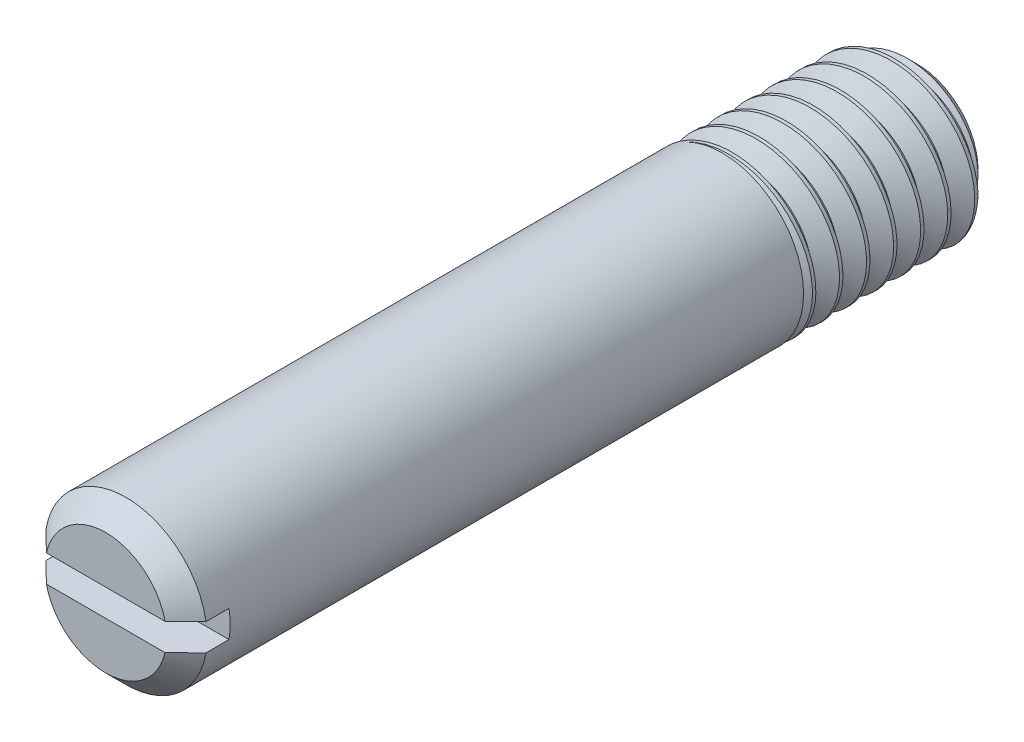
from build123d import *
from build123d.topology import SkipClean

# Parameters (mm, degrees)
SKETCH2_W               = 30
SKETCH2_H               = 3
CHAMFER2_SIZE           = 0.75
CUT_EXTRUDE1_DEPTH      = 24.191377708
CUT_EXTRUDE1_DEPTH_BACK = 24.191377708
SKETCH3_W               = 1.6
SKETCH3_H               = 1
CUT_SWEEP1_PITCH        = 1
BOSS_EXTRUDE2_START     = 1
SKETCH6_R               = 3
BOSS_EXTRUDE2_DEPTH     = 1


with BuildPart() as part:
    # Sketch2 → Revolve1 (revolve)
    with BuildSketch(Plane(origin=(0, 0, 0), x_dir=(0, 0, -1), z_dir=(1, 0, 0)), mode=Mode.PRIVATE) as revolve1_sk:
        with Locations((-7.8, 1.5)):
            Rectangle(SKETCH2_W, SKETCH2_H)
    revolve(revolve1_sk.sketch.rotate(Axis((0, 0, 22.8), (0, 0, -1)), 90), axis=Axis((0, 0, 22.8), (0, 0, -1)))

    # Chamfer2
    chamfer2_edges = [part.edges().sort_by_distance(p)[0] for p in [
        (-3, 0, 22.8),
        (-3, 0, -7.2),
    ]]
    chamfer(chamfer2_edges, length=CHAMFER2_SIZE)

    # Sketch3 → Cut-Extrude1 (cut, two sides: drawn at the far end of the back side and taken through both)
    with BuildSketch(Plane(origin=(0, 0, 0), x_dir=(0, 0, -1), z_dir=(1, 0, 0)).offset(-CUT_EXTRUDE1_DEPTH_BACK)):
        with Locations((-22, 0)):
            Rectangle(SKETCH3_W, SKETCH3_H)
    extrude(amount=CUT_EXTRUDE1_DEPTH + CUT_EXTRUDE1_DEPTH_BACK, mode=Mode.SUBTRACT)

    # Cut-Sweep1: the profile of Sketch5 profile screwed along a right-hand helix of 8.2 turns, 8 arcs to a turn; built about Z, then put on its axis
    cut_sweep1_z = Axis((0, 0, 0), (0, 0, 1))
    cut_sweep1_corners = [(3.0003, 0, 0.000173205), (3.0003, 0, -0.875173205), (2.350480947, 0, -0.5), (2.350480947, 0, -0.375)]
    with BuildLine(mode=Mode.PRIVATE) as cut_sweep1_profile:
        Line(cut_sweep1_corners[0], cut_sweep1_corners[1])
        Line(cut_sweep1_corners[1], cut_sweep1_corners[2])
        Line(cut_sweep1_corners[2], cut_sweep1_corners[3])
        Line(cut_sweep1_corners[3], cut_sweep1_corners[0])
    cut_sweep1_cap = Face(cut_sweep1_profile.wire())
    cut_sweep1_turn_angles = [0, 22.5, 45, 67.5, 90, 112.5, 135, 157.5, 180, 202.5, 225, 247.5, 270, 292.5, 315, 337.5, 360]
    cut_sweep1_turn_weights = [1, 0.9238795325112867, 1, 0.9238795325112867, 1, 0.9238795325112867, 1, 0.9238795325112867, 1, 0.9238795325112867, 1, 0.9238795325112867, 1, 0.9238795325112867, 1, 0.9238795325112867, 1]
    cut_sweep1_turn_rails = [Edge.make_bspline([Vector(p[0], p[1], 0).rotate(cut_sweep1_z, cut_sweep1_turn_angles[k]) / cut_sweep1_turn_weights[k] + Vector(0, 0, p[2] + CUT_SWEEP1_PITCH * cut_sweep1_turn_angles[k] / 360) for k in range(17)], [0, 0, 0, 1, 1, 2, 2, 3, 3, 4, 4, 5, 5, 6, 6, 7, 7, 8, 8, 8], 2, cut_sweep1_turn_weights) for p in cut_sweep1_corners]
    cut_sweep1_turn_sides = [Face.make_surface_from_curves(cut_sweep1_turn_rails[p[0]], cut_sweep1_turn_rails[p[1]]) for p in [(0, 1), (1, 2), (2, 3), (3, 0)]]
    cut_sweep1_last_angles = [2880, 2902.5, 2925, 2938.5, 2952]
    cut_sweep1_last_weights = [1, 0.9238795325112867, 1, 0.9723699203976692, 1]
    cut_sweep1_last_rails = [Edge.make_bspline([Vector(p[0], p[1], 0).rotate(cut_sweep1_z, cut_sweep1_last_angles[k]) / cut_sweep1_last_weights[k] + Vector(0, 0, p[2] + CUT_SWEEP1_PITCH * cut_sweep1_last_angles[k] / 360) for k in range(5)], [0, 0, 0, 1, 1, 2, 2, 2], 2, cut_sweep1_last_weights) for p in cut_sweep1_corners]
    cut_sweep1_last_sides = [Face.make_surface_from_curves(cut_sweep1_last_rails[p[0]], cut_sweep1_last_rails[p[1]]) for p in [(0, 1), (1, 2), (2, 3), (3, 0)]]
    cut_sweep1 = Plane(origin=(0, 0, -7.2), x_dir=(0, 1, 0), z_dir=(0, 0, 1)) * Solid(Shell([*[p.moved(Location((0, 0, CUT_SWEEP1_PITCH * i))) for i in range(8) for p in cut_sweep1_turn_sides], *cut_sweep1_last_sides, cut_sweep1_cap, cut_sweep1_cap.rotate(cut_sweep1_z, 2952).moved(Location((0, 0, CUT_SWEEP1_PITCH * 2952 / 360)))]))
    add(cut_sweep1, mode=Mode.SUBTRACT)

    # Sketch6 → Boss-Extrude2 (add)
    with SkipClean():  # the faces are left unmerged after this step: merging them gives an invalid solid
        with BuildSketch(Plane.XY.offset(BOSS_EXTRUDE2_START)):
            Circle(SKETCH6_R)
        extrude(amount=-BOSS_EXTRUDE2_DEPTH)


solid = part.part
